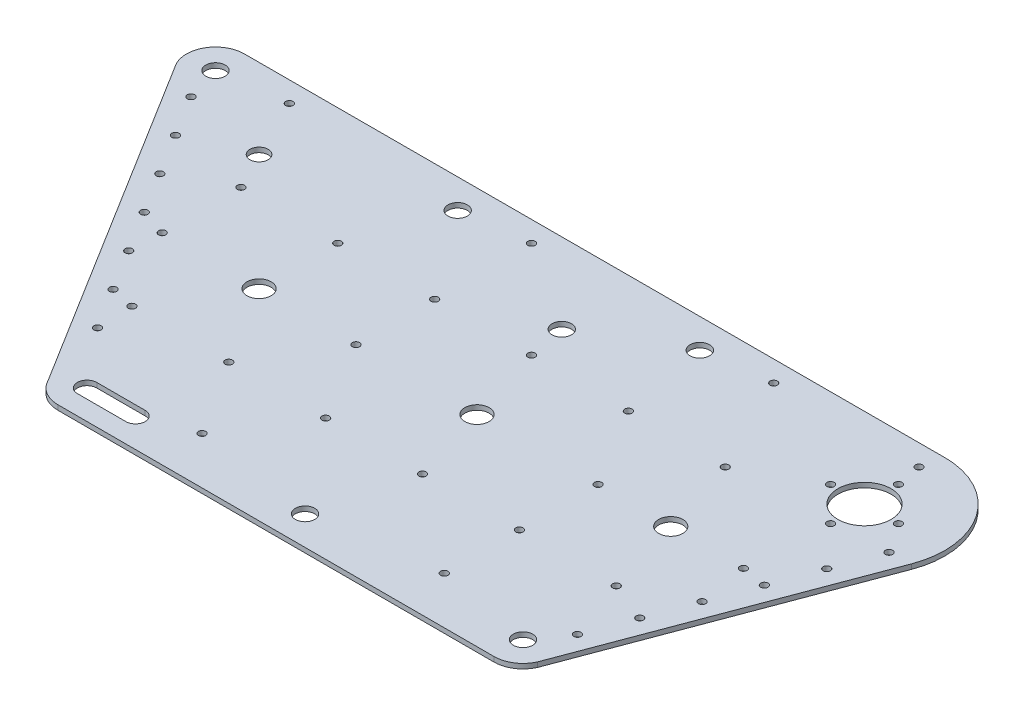
from build123d import *

# Parameters (mm, degrees)
SKETCH2_R           = 5
BOSS_EXTRUDE1_DEPTH = 2


with BuildPart() as part:
    # Sketch2 → Boss-Extrude1 (new body)
    with BuildSketch(Plane(origin=(0, 0, 0), x_dir=(1, 0, 0), z_dir=(0, 1, 0))):
        with BuildLine():
            Line((182.962816245, 145.197156615), (-106.00499968, 144.943614194))
            add(Edge.make_bspline(
                [(-106.00499968, 144.943614194), (-127.678824036, 144.924558741), (-116.08526313, 126.611232779)],
                knots=[0.000879148, 0.000879148, 0.000879148, 2.135198153, 2.135198153, 2.135198153], degree=2, weights=[1, 0.482613975, 1]))
            Line((-116.08526313, 126.611232779), (-29.699861268, -12.428586042))
            add(Edge.make_bspline(
                [(-29.699861268, -12.428586042), (-26.366669696, -18.999958873), (-18.998606102, -18.99996049)],
                knots=[5.181825727, 5.181825727, 5.181825727, 6.283185508, 6.283185508, 6.283185508], degree=2, weights=[1, 0.852168955, 1]))
            Line((-18.998606102, -18.99996049), (160.992350179, -19))
            add(Edge.make_bspline(
                [(160.992350179, -19), (168.692373591, -19.000128232), (171.90071668, -12.000000001)],
                knots=[3.141576001, 3.141576001, 3.141576001, 4.282613549, 4.282613549, 4.282613549], degree=2, weights=[1, 0.841620915, 1]))
            Line((171.90071668, -12.000000001), (214.069631291, 100.332253712))
            add(Edge.make_bspline(
                [(214.069631291, 100.332253712), (230.927799732, 145.239327045), (182.962816245, 145.197156615)],
                knots=[4.353250182, 4.353250182, 4.353250182, 6.284064455, 6.284064455, 6.284064455], degree=2, weights=[1, 0.569082143, 1]))
        make_face()
        with BuildLine():
            add(Edge.make_bspline(
                [(-38.361920415, 18.171266638), (-40.959866722, 18.171266638), (-39.660893568, 15.921266638), (-38.361920415, 13.671266638), (-37.062947261, 15.921266638), (-35.763974107, 18.171266638), (-38.361920415, 18.171266638)],
                knots=[0, 0, 0, 2.094395102, 2.094395102, 4.188790205, 4.188790205, 6.283185307, 6.283185307, 6.283185307], degree=2, weights=[1, 0.5, 1, 0.5, 1, 0.5, 1]))
        make_face(mode=Mode.SUBTRACT)
        with BuildLine():
            add(Edge.make_bspline(
                [(-18.998603467, -3), (-22.998556935, -3), (-22.998556935, -7), (-22.998556935, -11), (-18.998603467, -11)],
                knots=[3.141592654, 3.141592654, 3.141592654, 4.71238898, 4.71238898, 6.283185307, 6.283185307, 6.283185307], degree=2, weights=[1, 0.707106781, 1, 0.707106781, 1]))
            Line((-18.998603467, -3), (1.00035, -3))
            add(Edge.make_bspline(
                [(1.00035, -11), (5.00035, -11), (5.00035, -7), (5.00035, -3), (1.00035, -3)],
                knots=[3.141592654, 3.141592654, 3.141592654, 4.71238898, 4.71238898, 6.283185307, 6.283185307, 6.283185307], degree=2, weights=[1, 0.707106781, 1, 0.707106781, 1]))
            Line((1.00035, -11), (-18.998603467, -11))
        make_face(mode=Mode.SUBTRACT)
        with BuildLine():
            add(Edge.make_bspline(
                [(20.99895, 2), (18.401003692, 2), (19.699976846, -0.25), (20.99895, -2.5), (22.297923154, -0.25), (23.596896308, 2), (20.99895, 2)],
                knots=[0, 0, 0, 2.094395102, 2.094395102, 4.188790205, 4.188790205, 6.283185307, 6.283185307, 6.283185307], degree=2, weights=[1, 0.5, 1, 0.5, 1, 0.5, 1]))
        make_face(mode=Mode.SUBTRACT)
        with BuildLine():
            add(Edge.make_bspline(
                [(-38.99805, 32.999994311), (-41.595996308, 32.999994311), (-40.297023154, 30.749994311), (-38.99805, 28.499994311), (-37.699076846, 30.749994311), (-36.400103692, 32.999994311), (-38.99805, 32.999994311)],
                knots=[0, 0, 0, 2.094395102, 2.094395102, 4.188790205, 4.188790205, 6.283185307, 6.283185307, 6.283185307], degree=2, weights=[1, 0.5, 1, 0.5, 1, 0.5, 1]))
        make_face(mode=Mode.SUBTRACT)
        with BuildLine():
            add(Edge.make_bspline(
                [(-48.916261932, 35.158786529), (-51.51420824, 35.158786529), (-50.215235086, 32.908786529), (-48.916261932, 30.658786529), (-47.617288778, 32.908786529), (-46.318315625, 35.158786529), (-48.916261932, 35.158786529)],
                knots=[0, 0, 0, 2.094395102, 2.094395102, 4.188790205, 4.188790205, 6.283185307, 6.283185307, 6.283185307], degree=2, weights=[1, 0.5, 1, 0.5, 1, 0.5, 1]))
        make_face(mode=Mode.SUBTRACT)
        with BuildLine():
            add(Edge.make_bspline(
                [(-59.470762984, 52.146563195), (-62.068709292, 52.146563195), (-60.769736138, 49.896563195), (-59.470762984, 47.646563195), (-58.171789831, 49.896563195), (-56.872816677, 52.146563195), (-59.470762984, 52.146563195)],
                knots=[0, 0, 0, 2.094395102, 2.094395102, 4.188790205, 4.188790205, 6.283185307, 6.283185307, 6.283185307], degree=2, weights=[1, 0.5, 1, 0.5, 1, 0.5, 1]))
        make_face(mode=Mode.SUBTRACT)
        with BuildLine():
            add(Edge.make_bspline(
                [(0.99995, 32.999992415), (-1.597996308, 32.999992415), (-0.299023154, 30.749992415), (0.99995, 28.499992415), (2.298923154, 30.749992415), (3.597896308, 32.999992415), (0.99995, 32.999992415)],
                knots=[0, 0, 0, 2.094395102, 2.094395102, 4.188790205, 4.188790205, 6.283185307, 6.283185307, 6.283185307], degree=2, weights=[1, 0.5, 1, 0.5, 1, 0.5, 1]))
        make_face(mode=Mode.SUBTRACT)
        with BuildLine():
            add(Edge.make_bspline(
                [(40.99795, 32.999988622), (38.400003692, 32.999988622), (39.698976846, 30.749988622), (40.99795, 28.499988622), (42.296923154, 30.749988622), (43.595896308, 32.999988622), (40.99795, 32.999988622)],
                knots=[0, 0, 0, 2.094395102, 2.094395102, 4.188790205, 4.188790205, 6.283185307, 6.283185307, 6.283185307], degree=2, weights=[1, 0.5, 1, 0.5, 1, 0.5, 1]))
        make_face(mode=Mode.SUBTRACT)
        with BuildLine():
            add(Edge.make_bspline(
                [(66.99665, -7), (66.99665, -13.92820323), (72.99665, -10.464101615), (78.99665, -7), (72.99665, -3.535898385), (66.99665, -0.07179677), (66.99665, -7)],
                knots=[0, 0, 0, 2.094395102, 2.094395102, 4.188790205, 4.188790205, 6.283185307, 6.283185307, 6.283185307], degree=2, weights=[1, 0.5, 1, 0.5, 1, 0.5, 1]))
        make_face(mode=Mode.SUBTRACT)
        with BuildLine():
            add(Edge.make_bspline(
                [(120.99395, 2), (118.396003692, 2), (119.694976846, -0.25), (120.99395, -2.5), (122.292923154, -0.25), (123.591896308, 2), (120.99395, 2)],
                knots=[0, 0, 0, 2.094395102, 2.094395102, 4.188790205, 4.188790205, 6.283185307, 6.283185307, 6.283185307], degree=2, weights=[1, 0.5, 1, 0.5, 1, 0.5, 1]))
        make_face(mode=Mode.SUBTRACT)
        with BuildLine():
            add(Edge.make_bspline(
                [(160.99255, -3), (154.06434677, -3), (157.528448385, -9), (160.99255, -15), (164.456651615, -9), (167.92075323, -3), (160.99255, -3)],
                knots=[0, 0, 0, 2.094395102, 2.094395102, 4.188790205, 4.188790205, 6.283185307, 6.283185307, 6.283185307], degree=2, weights=[1, 0.5, 1, 0.5, 1, 0.5, 1]))
        make_face(mode=Mode.SUBTRACT)
        with BuildLine():
            add(Edge.make_bspline(
                [(170.332531489, 7.618627774), (167.734585182, 7.618627774), (169.033558335, 5.368627774), (170.332531489, 3.118627774), (171.631504643, 5.368627774), (172.930477797, 7.618627774), (170.332531489, 7.618627774)],
                knots=[0, 0, 0, 2.094395102, 2.094395102, 4.188790205, 4.188790205, 6.283185307, 6.283185307, 6.283185307], degree=2, weights=[1, 0.5, 1, 0.5, 1, 0.5, 1]))
        make_face(mode=Mode.SUBTRACT)
        with BuildLine():
            add(Edge.make_bspline(
                [(80.99595, 32.999985778), (78.398003692, 32.999985778), (79.696976846, 30.749985778), (80.99595, 28.499985778), (82.294923154, 30.749985778), (83.593896308, 32.999985778), (80.99595, 32.999985778)],
                knots=[0, 0, 0, 2.094395102, 2.094395102, 4.188790205, 4.188790205, 6.283185307, 6.283185307, 6.283185307], degree=2, weights=[1, 0.5, 1, 0.5, 1, 0.5, 1]))
        make_face(mode=Mode.SUBTRACT)
        with BuildLine():
            add(Edge.make_bspline(
                [(120.99395, 32.999981037), (118.396003692, 32.999981037), (119.694976846, 30.749981037), (120.99395, 28.499981037), (122.292923154, 30.749981037), (123.591896308, 32.999981037), (120.99395, 32.999981037)],
                knots=[0, 0, 0, 2.094395102, 2.094395102, 4.188790205, 4.188790205, 6.283185307, 6.283185307, 6.283185307], degree=2, weights=[1, 0.5, 1, 0.5, 1, 0.5, 1]))
        make_face(mode=Mode.SUBTRACT)
        with BuildLine():
            add(Edge.make_bspline(
                [(160.99195, 32.999978192), (158.394003692, 32.999978192), (159.692976846, 30.749978192), (160.99195, 28.499978192), (162.290923154, 30.749978192), (163.589896308, 32.999978192), (160.99195, 32.999978192)],
                knots=[0, 0, 0, 2.094395102, 2.094395102, 4.188790205, 4.188790205, 6.283185307, 6.283185307, 6.283185307], degree=2, weights=[1, 0.5, 1, 0.5, 1, 0.5, 1]))
        make_face(mode=Mode.SUBTRACT)
        with BuildLine():
            add(Edge.make_bspline(
                [(177.330672341, 26.354456596), (174.732726034, 26.354456596), (176.031699187, 24.104456596), (177.330672341, 21.854456596), (178.629645495, 24.104456596), (179.928618649, 26.354456596), (177.330672341, 26.354456596)],
                knots=[0, 0, 0, 2.094395102, 2.094395102, 4.188790205, 4.188790205, 6.283185307, 6.283185307, 6.283185307], degree=2, weights=[1, 0.5, 1, 0.5, 1, 0.5, 1]))
        make_face(mode=Mode.SUBTRACT)
        with BuildLine():
            add(Edge.make_bspline(
                [(184.328557385, 45.089600555), (181.730611078, 45.089600555), (183.029584232, 42.839600555), (184.328557385, 40.589600555), (185.627530539, 42.839600555), (186.926503693, 45.089600555), (184.328557385, 45.089600555)],
                knots=[0, 0, 0, 2.094395102, 2.094395102, 4.188790205, 4.188790205, 6.283185307, 6.283185307, 6.283185307], degree=2, weights=[1, 0.5, 1, 0.5, 1, 0.5, 1]))
        make_face(mode=Mode.SUBTRACT)
        with BuildLine():
            add(Edge.make_bspline(
                [(191.32646769, 63.824812144), (188.728521383, 63.824812144), (190.027494537, 61.574812144), (191.32646769, 59.324812144), (192.625440844, 61.574812144), (193.924413998, 63.824812144), (191.32646769, 63.824812144)],
                knots=[0, 0, 0, 2.094395102, 2.094395102, 4.188790205, 4.188790205, 6.283185307, 6.283185307, 6.283185307], degree=2, weights=[1, 0.5, 1, 0.5, 1, 0.5, 1]))
        make_face(mode=Mode.SUBTRACT)
        with BuildLine():
            add(Edge.make_bspline(
                [(-70.02547384, 69.134677545), (-72.623420147, 69.134677545), (-71.324446993, 66.884677545), (-70.02547384, 64.634677545), (-68.726500686, 66.884677545), (-67.427527532, 69.134677545), (-70.02547384, 69.134677545)],
                knots=[0, 0, 0, 2.094395102, 2.094395102, 4.188790205, 4.188790205, 6.283185307, 6.283185307, 6.283185307], degree=2, weights=[1, 0.5, 1, 0.5, 1, 0.5, 1]))
        make_face(mode=Mode.SUBTRACT)
        with BuildLine():
            add(Edge.make_bspline(
                [(-58.99705, 65.5), (-61.594996308, 65.5), (-60.296023154, 63.25), (-58.99705, 61), (-57.698076846, 63.25), (-56.399103692, 65.5), (-58.99705, 65.5)],
                knots=[0, 0, 0, 2.094395102, 2.094395102, 4.188790205, 4.188790205, 6.283185307, 6.283185307, 6.283185307], degree=2, weights=[1, 0.5, 1, 0.5, 1, 0.5, 1]))
        make_face(mode=Mode.SUBTRACT)
        with BuildLine():
            add(Edge.make_bspline(
                [(-91.134705429, 103.110600241), (-93.732651737, 103.110600241), (-92.433678583, 100.860600241), (-91.134705429, 98.610600241), (-89.835732276, 100.860600241), (-88.536759122, 103.110600241), (-91.134705429, 103.110600241)],
                knots=[0, 0, 0, 2.094395102, 2.094395102, 4.188790205, 4.188790205, 6.283185307, 6.283185307, 6.283185307], degree=2, weights=[1, 0.5, 1, 0.5, 1, 0.5, 1]))
        make_face(mode=Mode.SUBTRACT)
        with BuildLine():
            add(Edge.make_bspline(
                [(-80.580283096, 86.122950275), (-83.178229403, 86.122950275), (-81.87925625, 83.872950275), (-80.580283096, 81.622950275), (-79.281309942, 83.872950275), (-77.982336788, 86.122950275), (-80.580283096, 86.122950275)],
                knots=[0, 0, 0, 2.094395102, 2.094395102, 4.188790205, 4.188790205, 6.283185307, 6.283185307, 6.283185307], degree=2, weights=[1, 0.5, 1, 0.5, 1, 0.5, 1]))
        make_face(mode=Mode.SUBTRACT)
        with BuildLine():
            add(Edge.make_bspline(
                [(-58.99705, 98), (-61.594996308, 98), (-60.296023154, 95.75), (-58.99705, 93.5), (-57.698076846, 95.75), (-56.399103692, 98), (-58.99705, 98)],
                knots=[0, 0, 0, 2.094395102, 2.094395102, 4.188790205, 4.188790205, 6.283185307, 6.283185307, 6.283185307], degree=2, weights=[1, 0.5, 1, 0.5, 1, 0.5, 1]))
        make_face(mode=Mode.SUBTRACT)
        with Locations((-18.9988, 64)):
            Circle(SKETCH2_R, mode=Mode.SUBTRACT)
        with BuildLine():
            add(Edge.make_bspline(
                [(20.99895, 65.5), (18.401003692, 65.5), (19.699976846, 63.25), (20.99895, 61), (22.297923154, 63.25), (23.596896308, 65.5), (20.99895, 65.5)],
                knots=[0, 0, 0, 2.094395102, 2.094395102, 4.188790205, 4.188790205, 6.283185307, 6.283185307, 6.283185307], degree=2, weights=[1, 0.5, 1, 0.5, 1, 0.5, 1]))
        make_face(mode=Mode.SUBTRACT)
        with BuildLine():
            add(Edge.make_bspline(
                [(-18.99905, 98), (-21.596996308, 98), (-20.298023154, 95.75), (-18.99905, 93.5), (-17.700076846, 95.75), (-16.401103692, 98), (-18.99905, 98)],
                knots=[0, 0, 0, 2.094395102, 2.094395102, 4.188790205, 4.188790205, 6.283185307, 6.283185307, 6.283185307], degree=2, weights=[1, 0.5, 1, 0.5, 1, 0.5, 1]))
        make_face(mode=Mode.SUBTRACT)
        with BuildLine():
            add(Edge.make_bspline(
                [(20.99895, 98), (18.401003692, 98), (19.699976846, 95.75), (20.99895, 93.5), (22.297923154, 95.75), (23.596896308, 98), (20.99895, 98)],
                knots=[0, 0, 0, 2.094395102, 2.094395102, 4.188790205, 4.188790205, 6.283185307, 6.283185307, 6.283185307], degree=2, weights=[1, 0.5, 1, 0.5, 1, 0.5, 1]))
        make_face(mode=Mode.SUBTRACT)
        with BuildLine():
            add(Edge.make_bspline(
                [(-101.689209002, 120.098380963), (-104.287155309, 120.098380963), (-102.988182156, 117.848380963), (-101.689209002, 115.598380963), (-100.390235848, 117.848380963), (-99.091262694, 120.098380963), (-101.689209002, 120.098380963)],
                knots=[0, 0, 0, 2.094395102, 2.094395102, 4.188790205, 4.188790205, 6.283185307, 6.283185307, 6.283185307], degree=2, weights=[1, 0.5, 1, 0.5, 1, 0.5, 1]))
        make_face(mode=Mode.SUBTRACT)
        with BuildLine():
            add(Edge.make_bspline(
                [(-66.99665, 115.75), (-73.491515769, 115.75), (-70.244082884, 110.125), (-66.99665, 104.5), (-63.749217116, 110.125), (-60.501784231, 115.75), (-66.99665, 115.75)],
                knots=[0, 0, 0, 2.094395102, 2.094395102, 4.188790205, 4.188790205, 6.283185307, 6.283185307, 6.283185307], degree=2, weights=[1, 0.5, 1, 0.5, 1, 0.5, 1]))
        make_face(mode=Mode.SUBTRACT)
        with BuildLine():
            add(Edge.make_bspline(
                [(-109.9945, 133), (-109.9945, 126.07179677), (-103.9945, 129.535898385), (-97.9945, 133), (-103.9945, 136.464101615), (-109.9945, 139.92820323), (-109.9945, 133)],
                knots=[0, 0, 0, 2.094395102, 2.094395102, 4.188790205, 4.188790205, 6.283185307, 6.283185307, 6.283185307], degree=2, weights=[1, 0.5, 1, 0.5, 1, 0.5, 1]))
        make_face(mode=Mode.SUBTRACT)
        with BuildLine():
            add(Edge.make_bspline(
                [(-78.996040132, 138), (-81.59398644, 138), (-80.295013286, 135.75), (-78.996040132, 133.5), (-77.697066978, 135.75), (-76.398093824, 138), (-78.996040132, 138)],
                knots=[0, 0, 0, 2.094395102, 2.094395102, 4.188790205, 4.188790205, 6.283185307, 6.283185307, 6.283185307], degree=2, weights=[1, 0.5, 1, 0.5, 1, 0.5, 1]))
        make_face(mode=Mode.SUBTRACT)
        with BuildLine():
            add(Edge.make_bspline(
                [(-5.9995, 137), (-12.92770323, 137), (-9.463601615, 131), (-5.9995, 125), (-2.535398385, 131), (0.92870323, 137), (-5.9995, 137)],
                knots=[0, 0, 0, 2.094395102, 2.094395102, 4.188790205, 4.188790205, 6.283185307, 6.283185307, 6.283185307], degree=2, weights=[1, 0.5, 1, 0.5, 1, 0.5, 1]))
        make_face(mode=Mode.SUBTRACT)
        with BuildLine():
            add(Edge.make_bspline(
                [(20.99895, 138), (18.401003692, 138), (19.699976846, 135.75), (20.99895, 133.5), (22.297923154, 135.75), (23.596896308, 138), (20.99895, 138)],
                knots=[0, 0, 0, 2.094395102, 2.094395102, 4.188790205, 4.188790205, 6.283185307, 6.283185307, 6.283185307], degree=2, weights=[1, 0.5, 1, 0.5, 1, 0.5, 1]))
        make_face(mode=Mode.SUBTRACT)
        with Locations((70.99645, 64)):
            Circle(SKETCH2_R, mode=Mode.SUBTRACT)
        with BuildLine():
            add(Edge.make_bspline(
                [(120.99395, 65.5), (118.396003692, 65.5), (119.694976846, 63.25), (120.99395, 61), (122.292923154, 63.25), (123.591896308, 65.5), (120.99395, 65.5)],
                knots=[0, 0, 0, 2.094395102, 2.094395102, 4.188790205, 4.188790205, 6.283185307, 6.283185307, 6.283185307], degree=2, weights=[1, 0.5, 1, 0.5, 1, 0.5, 1]))
        make_face(mode=Mode.SUBTRACT)
        with BuildLine():
            add(Edge.make_bspline(
                [(60.99695, 98), (58.399003692, 98), (59.697976846, 95.75), (60.99695, 93.5), (62.295923154, 95.75), (63.594896308, 98), (60.99695, 98)],
                knots=[0, 0, 0, 2.094395102, 2.094395102, 4.188790205, 4.188790205, 6.283185307, 6.283185307, 6.283185307], degree=2, weights=[1, 0.5, 1, 0.5, 1, 0.5, 1]))
        make_face(mode=Mode.SUBTRACT)
        with BuildLine():
            add(Edge.make_bspline(
                [(100.99495, 98), (98.397003692, 98), (99.695976846, 95.75), (100.99495, 93.5), (102.293923154, 95.75), (103.592896308, 98), (100.99495, 98)],
                knots=[0, 0, 0, 2.094395102, 2.094395102, 4.188790205, 4.188790205, 6.283185307, 6.283185307, 6.283185307], degree=2, weights=[1, 0.5, 1, 0.5, 1, 0.5, 1]))
        make_face(mode=Mode.SUBTRACT)
        with BuildLine():
            add(Edge.make_bspline(
                [(140.99295, 98), (138.395003692, 98), (139.693976846, 95.75), (140.99295, 93.5), (142.291923154, 95.75), (143.590896308, 98), (140.99295, 98)],
                knots=[0, 0, 0, 2.094395102, 2.094395102, 4.188790205, 4.188790205, 6.283185307, 6.283185307, 6.283185307], degree=2, weights=[1, 0.5, 1, 0.5, 1, 0.5, 1]))
        make_face(mode=Mode.SUBTRACT)
        with Locations((150.9927, 64)):
            Circle(SKETCH2_R, mode=Mode.SUBTRACT)
        with BuildLine():
            add(Edge.make_bspline(
                [(180.99095, 65.5), (178.393003692, 65.5), (179.691976846, 63.25), (180.99095, 61), (182.289923154, 63.25), (183.588896308, 65.5), (180.99095, 65.5)],
                knots=[0, 0, 0, 2.094395102, 2.094395102, 4.188790205, 4.188790205, 6.283185307, 6.283185307, 6.283185307], degree=2, weights=[1, 0.5, 1, 0.5, 1, 0.5, 1]))
        make_face(mode=Mode.SUBTRACT)
        with BuildLine():
            add(Edge.make_bspline(
                [(198.324441471, 82.560193672), (195.726495163, 82.560193672), (197.025468317, 80.310193672), (198.324441471, 78.060193672), (199.623414624, 80.310193672), (200.922387778, 82.560193672), (198.324441471, 82.560193672)],
                knots=[0, 0, 0, 2.094395102, 2.094395102, 4.188790205, 4.188790205, 6.283185307, 6.283185307, 6.283185307], degree=2, weights=[1, 0.5, 1, 0.5, 1, 0.5, 1]))
        make_face(mode=Mode.SUBTRACT)
        with BuildLine():
            add(Edge.make_bspline(
                [(182.99085, 99.5), (180.392903692, 99.5), (181.691876846, 97.25), (182.99085, 95), (184.289823154, 97.25), (185.588796308, 99.5), (182.99085, 99.5)],
                knots=[0, 0, 0, 2.094395102, 2.094395102, 4.188790205, 4.188790205, 6.283185307, 6.283185307, 6.283185307], degree=2, weights=[1, 0.5, 1, 0.5, 1, 0.5, 1]))
        make_face(mode=Mode.SUBTRACT)
        with BuildLine():
            add(Edge.make_bspline(
                [(205.322481122, 101.295751553), (202.724534814, 101.295751553), (204.023507968, 99.045751553), (205.322481122, 96.795751553), (206.621454275, 99.045751553), (207.920427429, 101.295751553), (205.322481122, 101.295751553)],
                knots=[0, 0, 0, 2.094395102, 2.094395102, 4.188790205, 4.188790205, 6.283185307, 6.283185307, 6.283185307], degree=2, weights=[1, 0.5, 1, 0.5, 1, 0.5, 1]))
        make_face(mode=Mode.SUBTRACT)
        with BuildLine():
            add(Edge.make_bspline(
                [(53.9973, 112), (53.9973, 105.07179677), (59.9973, 108.535898385), (65.9973, 112), (59.9973, 115.464101615), (53.9973, 118.92820323), (53.9973, 112)],
                knots=[0, 0, 0, 2.094395102, 2.094395102, 4.188790205, 4.188790205, 6.283185307, 6.283185307, 6.283185307], degree=2, weights=[1, 0.5, 1, 0.5, 1, 0.5, 1]))
        make_face(mode=Mode.SUBTRACT)
        with BuildLine():
            add(Edge.make_bspline(
                [(89.995420809, 133), (89.995420809, 126.07179677), (95.995420809, 129.535898385), (101.995420809, 133), (95.995420809, 136.464101615), (89.995420809, 139.92820323), (89.995420809, 133)],
                knots=[0, 0, 0, 2.094395102, 2.094395102, 4.188790205, 4.188790205, 6.283185307, 6.283185307, 6.283185307], degree=2, weights=[1, 0.5, 1, 0.5, 1, 0.5, 1]))
        make_face(mode=Mode.SUBTRACT)
        with BuildLine():
            add(Edge.make_bspline(
                [(120.99395, 138), (118.396003692, 138), (119.694976846, 135.75), (120.99395, 133.5), (122.292923154, 135.75), (123.591896308, 138), (120.99395, 138)],
                knots=[0, 0, 0, 2.094395102, 2.094395102, 4.188790205, 4.188790205, 6.283185307, 6.283185307, 6.283185307], degree=2, weights=[1, 0.5, 1, 0.5, 1, 0.5, 1]))
        make_face(mode=Mode.SUBTRACT)
        with BuildLine():
            add(Edge.make_bspline(
                [(168.99155, 113.5), (166.393603692, 113.5), (167.692576846, 111.25), (168.99155, 109), (170.290523154, 111.25), (171.589496308, 113.5), (168.99155, 113.5)],
                knots=[0, 0, 0, 2.094395102, 2.094395102, 4.188790205, 4.188790205, 6.283185307, 6.283185307, 6.283185307], degree=2, weights=[1, 0.5, 1, 0.5, 1, 0.5, 1]))
        make_face(mode=Mode.SUBTRACT)
        with BuildLine():
            ThreePointArc((182.992000002, 122.999999999), (190.770174595, 119.778174592), (193.992000002, 111.999999999))
            ThreePointArc((193.992000002, 111.999999999), (175.213825408, 104.221825406), (182.992000002, 122.999999999))
        make_face(mode=Mode.SUBTRACT)
        with BuildLine():
            add(Edge.make_bspline(
                [(196.99015, 113.5), (194.392203692, 113.5), (195.691176846, 111.25), (196.99015, 109), (198.289123154, 111.25), (199.588096308, 113.5), (196.99015, 113.5)],
                knots=[0, 0, 0, 2.094395102, 2.094395102, 4.188790205, 4.188790205, 6.283185307, 6.283185307, 6.283185307], degree=2, weights=[1, 0.5, 1, 0.5, 1, 0.5, 1]))
        make_face(mode=Mode.SUBTRACT)
        with BuildLine():
            add(Edge.make_bspline(
                [(182.99085, 127.5), (180.392903692, 127.5), (181.691876846, 125.25), (182.99085, 123), (184.289823154, 125.25), (185.588796308, 127.5), (182.99085, 127.5)],
                knots=[0, 0, 0, 2.094395102, 2.094395102, 4.188790205, 4.188790205, 6.283185307, 6.283185307, 6.283185307], degree=2, weights=[1, 0.5, 1, 0.5, 1, 0.5, 1]))
        make_face(mode=Mode.SUBTRACT)
        with BuildLine():
            add(Edge.make_bspline(
                [(180.99095, 138), (178.393003692, 138), (179.691976846, 135.75), (180.99095, 133.5), (182.289923154, 135.75), (183.588896308, 138), (180.99095, 138)],
                knots=[0, 0, 0, 2.094395102, 2.094395102, 4.188790205, 4.188790205, 6.283185307, 6.283185307, 6.283185307], degree=2, weights=[1, 0.5, 1, 0.5, 1, 0.5, 1]))
        make_face(mode=Mode.SUBTRACT)
    extrude(amount=BOSS_EXTRUDE1_DEPTH)


solid = part.part
